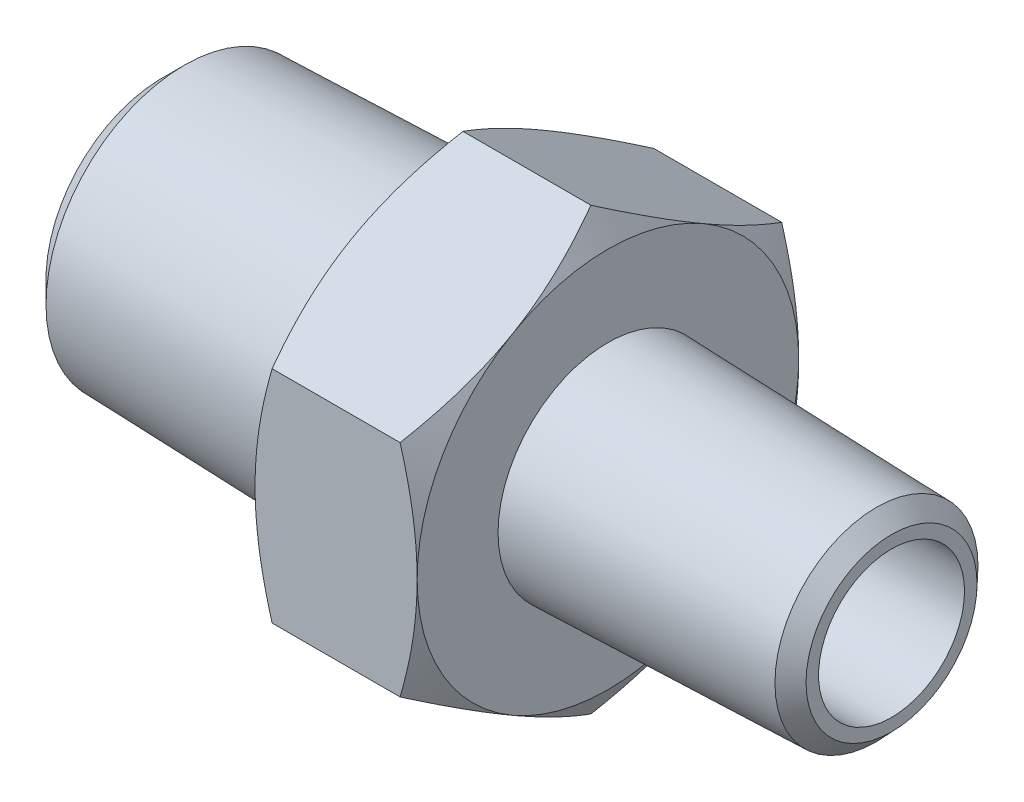
from build123d import *

# Parameters (mm, degrees)
SKETCH2_R           = 6.858
EXTRUDE1_DEPTH      = 13.273264
EXTRUDE1_DRAFT      = -1.783333333
CHAMFER1_SIZE       = 1.002631579
CHAMFER1_SIZE2      = 1.035353254
SKETCH5_R           = 5.1435
EXTRUDE2_DEPTH      = 13.273264
EXTRUDE2_TAPER      = 1.783333333
CHAMFER2_SIZE       = 0.705555556
CHAMFER2_SIZE_2     = 0.728581919
EXTRUDE3_DEPTH      = 3.792361
EXTRUDE3_DEPTH_BACK = 3.792361
SKETCH10_OUTSIDE_W  = 118.396
SKETCH10_OUTSIDE_H  = 121.158
SKETCH10_OUTSIDE_R  = 8.9296875
CUT_EXTRUDE1_DEPTH  = 25.922158813
CUT_EXTRUDE1_DRAFT  = -60
SKETCH11_OUTSIDE_W  = 118.396
SKETCH11_OUTSIDE_H  = 121.158
SKETCH11_OUTSIDE_R  = 8.9296875
CUT_EXTRUDE2_DEPTH  = 25.922158813
CUT_EXTRUDE2_DRAFT  = -60
SKETCH12_R          = 4.6228
CUT_EXTRUDE3_DEPTH  = 13.273265
SKETCH13_R          = 3.4163
CUT_EXTRUDE4_DEPTH  = 37.75596067


with BuildPart() as part:
    # Sketch2 → Extrude1 (with draft: the straight prism first)
    with BuildSketch(Plane(origin=(-3.792361111, 0, 0), x_dir=(0, 0, -1), z_dir=(1, 0, 0))):
        Circle(SKETCH2_R)
    extrude(amount=-EXTRUDE1_DEPTH)
    # Extrude1: the draft: its side faces are tilted about the plane it starts from
    extrude1_sides = [part.faces().sort_by_distance(p)[0] for p in [
        (-10.428993111, 0, 6.858),
    ]]
    draft(extrude1_sides, Plane(origin=(-3.792361111, 0, 0), x_dir=(0, 0, -1), z_dir=(1, 0, 0)), EXTRUDE1_DRAFT)

    # Chamfer1
    chamfer1_edges = [part.edges().sort_by_distance(p)[0] for p in [
        (-17.065625111, 0, 6.444735688),
    ]]
    chamfer1_side = [part.faces().sort_by_distance(p)[0] for p in [
        (-17.065625111, 0, 0),
    ]]
    chamfer(chamfer1_edges, length=CHAMFER1_SIZE, length2=CHAMFER1_SIZE2, reference=chamfer1_side[0])



with BuildPart() as body_2:
    # Sketch5 → Extrude2 (new body)
    with BuildSketch(Plane(origin=(3.792361111, 0, 0), x_dir=(0, 0, -1), z_dir=(1, 0, 0))):
        Circle(SKETCH5_R)
    extrude(amount=EXTRUDE2_DEPTH, taper=EXTRUDE2_TAPER)

    # Chamfer2
    # the kernel refuses this chamfer: 0.728581919, 0.705555556 mm, written as the material it takes off along each edge
    with BuildSketch(Plane(origin=(17.065625111, 0, 0), x_dir=(0, 0, -1), z_dir=(0, 1, 0))) as chamfer2_piece_1:
        Polygon((4.730235688 + CHAMFER2_SIZE * 0.0311200130608, CHAMFER2_SIZE * 0.999515654468), (4.730235688 - CHAMFER2_SIZE_2, 0), (4.730235688, 0), align=None)
    revolve(axis=Axis((17.065625111, 0, 0), (-1, 0, 0)), mode=Mode.SUBTRACT)


with BuildPart() as part_1:
    add(part.part)

    add(body_2.part)  # Revolve1 merges body 2
    # Sketch8 → Revolve1 (revolve)
    with BuildSketch(Plane.XY, mode=Mode.PRIVATE) as revolve1_sk:
        Polygon((0, 6.858), (-3.792361111, 6.858), (-10.476571637, 5.066971187), (-10.476571637, 0), (10.476571637, 0), (10.476571637, 3.352471187), (3.792361111, 5.1435), (0, 5.1435), align=None)
    revolve(revolve1_sk.sketch.rotate(Axis((-17.065625, 0, 0), (1, 0, 0)), 90), axis=Axis((-17.065625, 0, 0), (1, 0, 0)))

    # Sketch9 → Extrude3 (add, two sides: drawn at the far end of the back side and taken through both)
    with BuildSketch(Plane(origin=(0, 0, 0), x_dir=(0, 0, -1), z_dir=(1, 0, 0)).offset(-EXTRUDE3_DEPTH_BACK)):
        Polygon((0, 10.311114964), (-8.9296875, 5.155557482), (-8.9296875, -5.155557482), (0, -10.311114964), (8.9296875, -5.155557482), (8.9296875, 5.155557482), align=None)
    extrude(amount=EXTRUDE3_DEPTH + EXTRUDE3_DEPTH_BACK)


with BuildPart() as cut_extrude1_tool:
    # Sketch10 outside → Cut-Extrude1 (with draft: the straight prism first)
    with BuildSketch(Plane(origin=(3.792361111, 0, 0), x_dir=(0, 0, -1), z_dir=(1, 0, 0))):
        Rectangle(SKETCH10_OUTSIDE_W, SKETCH10_OUTSIDE_H)
        Circle(SKETCH10_OUTSIDE_R, mode=Mode.SUBTRACT)
    extrude(amount=-CUT_EXTRUDE1_DEPTH)
    # Cut-Extrude1: the draft: its side faces are tilted about the plane it starts from
    cut_extrude1_sides = [cut_extrude1_tool.faces().sort_by_distance(p)[0] for p in [
        (-9.168718295, -60.579, 0),
        (-9.168718295, 0, -59.198),
        (-9.168718295, 60.579, 0),
        (-9.168718295, 0, 59.198),
        (-9.168718295, 0, 8.9296875),
    ]]
    draft(cut_extrude1_sides, Plane(origin=(3.792361111, 0, 0), x_dir=(0, 0, -1), z_dir=(1, 0, 0)), CUT_EXTRUDE1_DRAFT)


with BuildPart() as part_2:
    add(part_1.part)

    # Cut-Extrude1: cut by cut_extrude1_tool
    add(cut_extrude1_tool.part, mode=Mode.SUBTRACT)


with BuildPart() as cut_extrude2_tool:
    # Sketch11 outside → Cut-Extrude2 (with draft: the straight prism first)
    with BuildSketch(Plane.ZY.offset(3.792361111)):
        Rectangle(SKETCH11_OUTSIDE_W, SKETCH11_OUTSIDE_H)
        Circle(SKETCH11_OUTSIDE_R, mode=Mode.SUBTRACT)
    extrude(amount=-CUT_EXTRUDE2_DEPTH)
    # Cut-Extrude2: the draft: its side faces are tilted about the plane it starts from
    cut_extrude2_sides = [cut_extrude2_tool.faces().sort_by_distance(p)[0] for p in [
        (9.168718295, -60.579, 0),
        (9.168718295, 0, 59.198),
        (9.168718295, 60.579, 0),
        (9.168718295, 0, -59.198),
        (9.168718295, 0, -8.9296875),
    ]]
    draft(cut_extrude2_sides, Plane.ZY.offset(3.792361111), CUT_EXTRUDE2_DRAFT)


with BuildPart() as part_3:
    add(part_2.part)

    # Cut-Extrude2: cut by cut_extrude2_tool
    add(cut_extrude2_tool.part, mode=Mode.SUBTRACT)

    # Sketch12 → Cut-Extrude3 (cut)
    with BuildSketch(Plane.ZY.offset(17.065625)):
        Circle(SKETCH12_R)
    extrude(amount=-CUT_EXTRUDE3_DEPTH, mode=Mode.SUBTRACT)

    # Sketch13 → Cut-Extrude4 (cut, through all)
    with BuildSketch(Plane(origin=(17.065625, 0, 0), x_dir=(0, 0, -1), z_dir=(1, 0, 0))):
        Circle(SKETCH13_R)
    extrude(amount=-CUT_EXTRUDE4_DEPTH, mode=Mode.SUBTRACT)

    # Cut-Extrude5 cone 1 section (through the dimple's axis) → Cut-Extrude5 (revolve, cut)
    with BuildSketch(Plane(origin=(-3.792361111, 0, 0), x_dir=(0, 0, 1), z_dir=(0, 1, 0))):
        Polygon((0, 0), (4.6228, 0), (0, 5.317923073), align=None)
    revolve(axis=Axis((-3.792361111, 0, 0), (1, 0, 0)), mode=Mode.SUBTRACT)


solid = part_3.part
